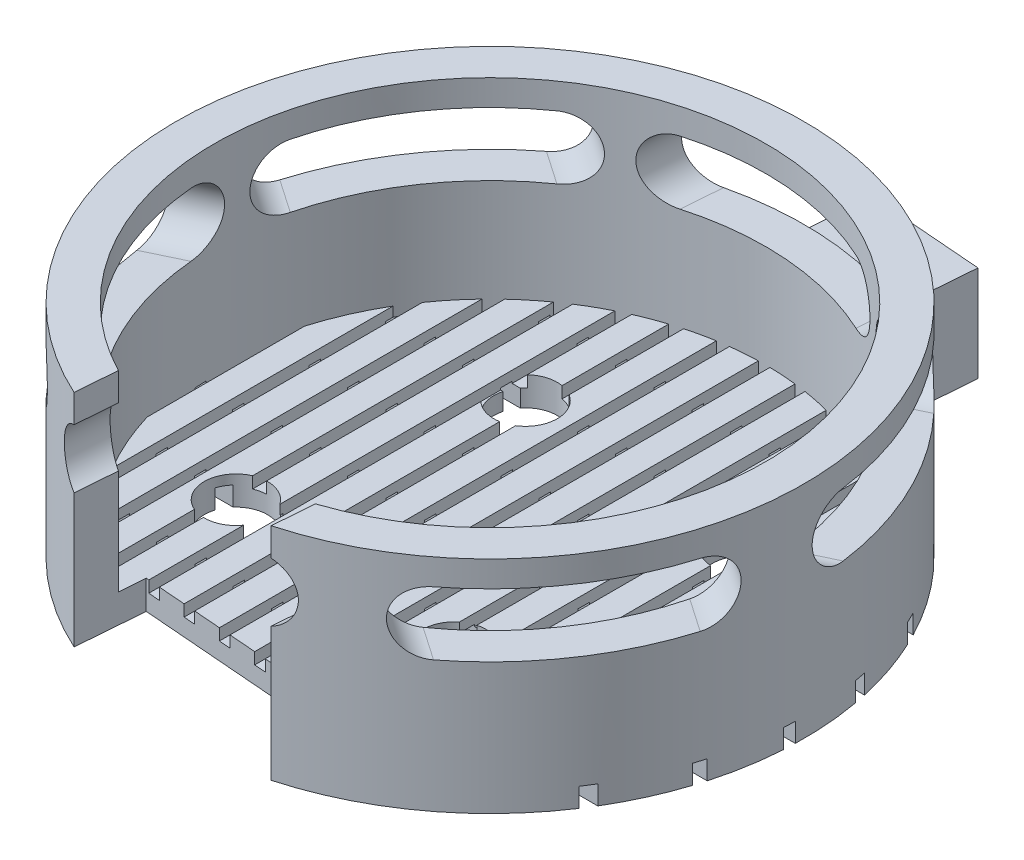
from build123d import *

# Parameters (mm, degrees)
ESQUISSE1_R                                = 16.375
ESQUISSE1_R_2                              = 14.375
BOSS_EXTRU_1_DEPTH                         = 10
BOSS_EXTRU_2_START                         = 1.5
ESQUISSE2_R                                = 16.375
BOSS_EXTRU_2_DEPTH                         = 1.5
ESQUISSE3_R                                = 1.65
ENL_V_MAT_EXTRU_1_DEPTH                    = 1.5
ENL_V_MAT_EXTRU_2_DEPTH                    = 16
ENL_V_MAT_EXTRU_3_DEPTH                    = 35
R_P_TITION_CIRCULAIRE1_COUNT               = 6
R_P_TITION_CIRCULAIRE1_THE_OTHER_WAY_COUNT = 2
R_P_TITION_CIRCULAIRE1_THE_OTHER_WAY_ANGLE = 60
ENL_V_START                                = -0.6
ENL_V_MAT_EXTRU_4_DEPTH                    = 0.6
BOSS_EXTRU_3_REACH                         = 46.026
BOSS_EXTRU_3_END_RADIUS                    = 16.375
ESQUISSE8_W                                = 6
ESQUISSE8_H                                = 5
ESQUISSE9_W                                = 2.012840876
ESQUISSE9_H                                = 5
ENL_V_MAT_EXTRU_5_DEPTH                    = 8.6
ESQUISSE11_W                               = 40
ESQUISSE11_H                               = 0.6
ENL_V_MAT_EXTRU_6_DEPTH                    = 1
R_P_TITION_LIN_AIRE1_COUNT                 = 7
R_P_TITION_LIN_AIRE1_PITCH                 = 4


with BuildPart() as part:
    # Esquisse1 → Boss.-Extru.1 (new body)
    with BuildSketch(Plane(origin=(0, 0, 0), x_dir=(1, 0, 0), z_dir=(0, 1, 0))):
        Circle(ESQUISSE1_R)
        Circle(ESQUISSE1_R_2, mode=Mode.SUBTRACT)
    extrude(amount=BOSS_EXTRU_1_DEPTH)

    # Esquisse2 → Boss.-Extru.2 (add)
    with BuildSketch(Plane.XZ.offset(BOSS_EXTRU_2_START)):
        Circle(ESQUISSE2_R)
    extrude(amount=-BOSS_EXTRU_2_DEPTH)

    # Esquisse3 → Enlèv. mat.-Extru.1 (cut)
    with BuildSketch(Plane.XZ.offset(1.5)):
        with Locations((-7.726941456, 5.526696639)):
            Circle(ESQUISSE3_R)
        with Locations((4.654060327, 6.506898068)):
            Circle(ESQUISSE3_R)
        with Locations((-4.654060327, -6.506898068)):
            Circle(ESQUISSE3_R)
        with Locations((7.726941456, -5.526696639)):
            Circle(ESQUISSE3_R)
    extrude(amount=-ENL_V_MAT_EXTRU_1_DEPTH, mode=Mode.SUBTRACT)

    # Esquisse4 → Enlèv. mat.-Extru.2 (cut)
    with BuildSketch(Plane.XZ.offset(1.5)):
        Polygon((-6.519278938, 11.410385821), (4.642601946, 12.294069693), (3.934555687, 21.237457994), (-7.227325198, 20.353774121), align=None)
    extrude(amount=-ENL_V_MAT_EXTRU_2_DEPTH, mode=Mode.SUBTRACT)

    # Esquisse6 → Enlèv. mat.-Extru.3 (cut)
    with BuildSketch(Plane(origin=(-0.938338496, 0, 11.852227757), x_dir=(0.9968807271497419, 0, 0.07892284737262044), z_dir=(-0.07892284737262044, 0, 0.9968807271497419))):
        with BuildLine():
            Line((-5, 8.65), (5, 8.65))
            ThreePointArc((5, 8.65), (6.65, 7), (5, 5.35))
            Line((5, 5.35), (-5, 5.35))
            ThreePointArc((-5, 5.35), (-6.65, 7), (-5, 8.65))
        make_face()
    enl_v_mat_extru_3 = extrude(amount=-ENL_V_MAT_EXTRU_3_DEPTH, mode=Mode.SUBTRACT)

    # Répétition circulaire1: Enlèv. mat.-Extru.3 ×6 about axis
    r_p_tition_circulaire1_axis = Axis((0, -1.5, 0), (0, -1, 0))
    for i in range(1, R_P_TITION_CIRCULAIRE1_COUNT):
        add(enl_v_mat_extru_3.rotate(r_p_tition_circulaire1_axis, i * 360 / R_P_TITION_CIRCULAIRE1_COUNT), mode=Mode.SUBTRACT)

    # Répétition circulaire1 the other way: Enlèv. mat.-Extru.3 ×2 about axis
    r_p_tition_circulaire1_the_other_way_axis = Axis((0, -1.5, 0), (0, 1, 0))
    for i in range(1, R_P_TITION_CIRCULAIRE1_THE_OTHER_WAY_COUNT):
        add(enl_v_mat_extru_3.rotate(r_p_tition_circulaire1_the_other_way_axis, i * R_P_TITION_CIRCULAIRE1_THE_OTHER_WAY_ANGLE / (R_P_TITION_CIRCULAIRE1_THE_OTHER_WAY_COUNT - 1)), mode=Mode.SUBTRACT)

    # Esquisse7 → Enlèv. mat.-Extru.4 (cut)
    with BuildSketch(Plane(origin=(0, 0, 0), x_dir=(1, 0, 0), z_dir=(0, 1, 0)).offset(ENL_V_START)):
        with BuildLine():
            Line((-12.375, 7.314369419), (-12.375, -7.314369419))
            ThreePointArc((-12.375, -7.314369419), (-12.083973886, -7.785769077), (-11.775, -8.24560489))
            Line((-11.775, -8.24560489), (-11.775, 8.24560489))
            ThreePointArc((-11.775, 8.24560489), (-12.083973886, 7.785769077), (-12.375, 7.314369419))
        make_face()
        with BuildLine():
            ThreePointArc((-13.775, 4.109744518), (-14.375, 0), (-13.775, -4.109744518))
            Line((-13.775, -4.109744518), (-13.775, 4.109744518))
        make_face()
        with BuildLine():
            Line((-10.375, 9.949874371), (-10.375, -9.949874371))
            ThreePointArc((-10.375, -9.949874371), (-10.079318661, -10.249290723), (-9.775, -10.539924098))
            Line((-9.775, -10.539924098), (-9.775, 10.539924098))
            ThreePointArc((-9.775, 10.539924098), (-10.079318661, 10.249290723), (-10.375, 9.949874371))
        make_face()
        with BuildLine():
            Line((-8.375, -7.04410236), (-8.375, -11.683321446))
            ThreePointArc((-8.375, -11.683321446), (-8.077571184, -11.890898569), (-7.775, -12.090905673))
            Line((-7.775, -12.090905673), (-7.775, -7.175996604))
            ThreePointArc((-7.775, -7.175996604), (-8.081192459, -7.138219591), (-8.375, -7.04410236))
        make_face()
        with BuildLine():
            ThreePointArc((-7.775, 12.090905673), (-8.077571184, 11.890898569), (-8.375, 11.683321446))
            Line((-8.375, 11.683321446), (-8.375, -4.009290917))
            ThreePointArc((-8.375, -4.009290917), (-8.081192459, -3.915173686), (-7.775, -3.877396673))
            Line((-7.775, -3.877396673), (-7.775, 12.090905673))
        make_face()
        with BuildLine():
            ThreePointArc((-5.775, 13.163965968), (-6.076611426, 13.02748704), (-6.375, 12.884098727))
            Line((-6.375, 12.884098727), (-6.375, -4.580782108))
            ThreePointArc((-6.375, -4.580782108), (-6.076941456, -5.526696639), (-6.375, -6.472611169))
            Line((-6.375, -6.472611169), (-6.375, -11.421808355))
            Line((-6.375, -11.421808355), (-5.775, -11.469310235))
            Line((-5.775, -11.469310235), (-5.775, 5.296115573))
            ThreePointArc((-5.775, 5.296115573), (-6.304060327, 6.506898068), (-5.775, 7.717680563))
            Line((-5.775, 7.717680563), (-5.775, 13.163965968))
        make_face()
        with BuildLine():
            ThreePointArc((-3.775, 13.870472234), (-4.075965337, 13.785032883), (-4.375, 13.693063938))
            Line((-4.375, 13.693063938), (-4.375, 8.133128474))
            ThreePointArc((-4.375, 8.133128474), (-4.063701305, 8.047669377), (-3.775, 7.903233609))
            Line((-3.775, 7.903233609), (-3.775, 13.870472234))
        make_face()
        with BuildLine():
            Line((-4.375, 4.880667662), (-4.375, -11.580147954))
            Line((-4.375, -11.580147954), (-3.775, -11.627649834))
            Line((-3.775, -11.627649834), (-3.775, 5.110562528))
            ThreePointArc((-3.775, 5.110562528), (-4.063701305, 4.96612676), (-4.375, 4.880667662))
        make_face()
        with BuildLine():
            ThreePointArc((-1.775, 14.264992114), (-2.075461646, 14.22438343), (-2.375, 14.177446879))
            Line((-2.375, 14.177446879), (-2.375, -11.738487554))
            Line((-2.375, -11.738487554), (-1.775, -11.785989433))
            Line((-1.775, -11.785989433), (-1.775, 14.264992114))
        make_face()
        with BuildLine():
            ThreePointArc((0.225, 14.373239023), (-0.075016338, 14.374804261), (-0.375, 14.370107863))
            Line((-0.375, 14.370107863), (-0.375, -11.896827153))
            Line((-0.375, -11.896827153), (0.225, -11.944329032))
            Line((0.225, -11.944329032), (0.225, 14.373239023))
        make_face()
        with BuildLine():
            ThreePointArc((2.225, 14.201760454), (1.925427006, 14.245467905), (1.625, 14.282856857))
            Line((1.625, 14.282856857), (1.625, -12.055166752))
            Line((1.625, -12.055166752), (2.225, -12.102668632))
            Line((2.225, -12.102668632), (2.225, 14.201760454))
        make_face()
        with BuildLine():
            ThreePointArc((4.225, 13.740087336), (3.925923963, 13.828512069), (3.625, 13.910427743))
            Line((3.625, 13.910427743), (3.625, -5.21711714))
            ThreePointArc((3.625, -5.21711714), (3.909378848, -5.034502233), (4.225, -4.913660096))
            Line((4.225, -4.913660096), (4.225, 13.740087336))
        make_face()
        with BuildLine():
            Line((3.625, -7.796678997), (3.625, -12.213506351))
            Line((3.625, -12.213506351), (4.225, -12.261008231))
            Line((4.225, -12.261008231), (4.225, -8.10013604))
            ThreePointArc((4.225, -8.10013604), (3.909378848, -7.979293903), (3.625, -7.796678997))
        make_face()
        with BuildLine():
            ThreePointArc((6.225, 12.95723736), (5.926555127, 13.096433458), (5.625, 13.228756555))
            Line((5.625, 13.228756555), (5.625, -5.172815555))
            ThreePointArc((5.625, -5.172815555), (5.990954754, -5.539833804), (6.225, -6.002270934))
            Line((6.225, -6.002270934), (6.225, 4.843562785))
            ThreePointArc((6.225, 4.843562785), (6.076941456, 5.526696639), (6.225, 6.209830493))
            Line((6.225, 6.209830493), (6.225, 12.95723736))
        make_face()
        with BuildLine():
            Line((5.625, -7.840980581), (5.625, -13.228756555))
            ThreePointArc((5.625, -13.228756555), (5.926555127, -13.096433458), (6.225, -12.95723736))
            Line((6.225, -12.95723736), (6.225, -7.011525202))
            ThreePointArc((6.225, -7.011525202), (5.990954754, -7.473962333), (5.625, -7.840980581))
        make_face()
        with BuildLine():
            ThreePointArc((8.225, 11.78940202), (7.927481246, 11.991483065), (7.625, 12.186057607))
            Line((7.625, 12.186057607), (7.625, 7.173544518))
            ThreePointArc((7.625, 7.173544518), (7.928409292, 7.164350665), (8.225, 7.099731186))
            Line((8.225, 7.099731186), (8.225, 11.78940202))
        make_face()
        with BuildLine():
            Line((7.625, 3.879848759), (7.625, -12.186057607))
            ThreePointArc((7.625, -12.186057607), (7.927481246, -11.991483065), (8.225, -11.78940202))
            Line((8.225, -11.78940202), (8.225, 3.953662091))
            ThreePointArc((8.225, 3.953662091), (7.928409292, 3.889042612), (7.625, 3.879848759))
        make_face()
        with BuildLine():
            ThreePointArc((10.225, 10.10395962), (9.929135977, 10.394848905), (9.625, 10.677078252))
            Line((9.625, 10.677078252), (9.625, -10.677078252))
            ThreePointArc((9.625, -10.677078252), (9.929135977, -10.394848905), (10.225, -10.10395962))
            Line((10.225, -10.10395962), (10.225, 10.10395962))
        make_face()
        with BuildLine():
            ThreePointArc((12.225, 7.562407024), (11.933362817, 8.014703792), (11.625, 8.455767263))
            Line((11.625, 8.455767263), (11.625, -8.455767263))
            ThreePointArc((11.625, -8.455767263), (11.933362817, -8.014703792), (12.225, -7.562407024))
            Line((12.225, -7.562407024), (12.225, 7.562407024))
        make_face()
        with BuildLine():
            ThreePointArc((14.225, 2.071231518), (13.981499826, 3.340402312), (13.625, 4.582575695))
            Line((13.625, 4.582575695), (13.625, -4.582575695))
            ThreePointArc((13.625, -4.582575695), (13.981499826, -3.340402312), (14.225, -2.071231518))
            Line((14.225, -2.071231518), (14.225, 2.071231518))
        make_face()
    extrude(amount=ENL_V_MAT_EXTRU_4_DEPTH, mode=Mode.SUBTRACT)

    # Boss.-Extru.3: up to this cylinder (the profile starts outside it)
    boss_extru_3_end = Plane(origin=(0, 1, 0), z_dir=(0, -1, 0)) * Cylinder(BOSS_EXTRU_3_END_RADIUS, 125.802, mode=Mode.PRIVATE)
    # Esquisse8 → Boss.-Extru.3 (add, up to the surface)
    with BuildSketch(Plane(origin=(1.823961162, 0, -23.038597693), x_dir=(0.9968807271497419, 0, 0.07892284737262044), z_dir=(-0.07892284737262044, 0, 0.9968807271497419)), mode=Mode.PRIVATE) as boss_extru_3_sk1:
        with Locations((0, 1)):
            Rectangle(ESQUISSE8_W, ESQUISSE8_H)
    boss_extru_3_tool1 = extrude(boss_extru_3_sk1.sketch, amount=BOSS_EXTRU_3_REACH, mode=Mode.PRIVATE) - boss_extru_3_end
    add(boss_extru_3_tool1.solids().sort_by_distance((1.823961, 1, -23.038598))[0])

    # Esquisse9 → Enlèv. mat.-Extru.5 (cut)
    with BuildSketch(Plane(origin=(2.990642181, 0, 0.236768542), x_dir=(0.07892284737262047, 0, -0.9968807271497419), z_dir=(0.9968807271497419, 0, 0.07892284737262047))):
        with Locations((22.104265791, 1)):
            Rectangle(ESQUISSE9_W, ESQUISSE9_H)
    extrude(amount=-ENL_V_MAT_EXTRU_5_DEPTH, mode=Mode.SUBTRACT)

    # Esquisse11 → Enlèv. mat.-Extru.6 (cut)
    with BuildSketch(Plane.XZ.offset(1.5)):
        with Locations((0, -15.203418701)):
            Rectangle(ESQUISSE11_W, ESQUISSE11_H)
    enl_v_mat_extru_6 = extrude(amount=-ENL_V_MAT_EXTRU_6_DEPTH, mode=Mode.SUBTRACT)

    # Répétition linéaire1: Enlèv. mat.-Extru.6 ×7
    with Locations(*[Vector(-0.07892284737262045, 0, 0.996880727149742) * (i * R_P_TITION_LIN_AIRE1_PITCH) for i in range(1, R_P_TITION_LIN_AIRE1_COUNT)]):
        add(enl_v_mat_extru_6, mode=Mode.SUBTRACT)


solid = part.part
